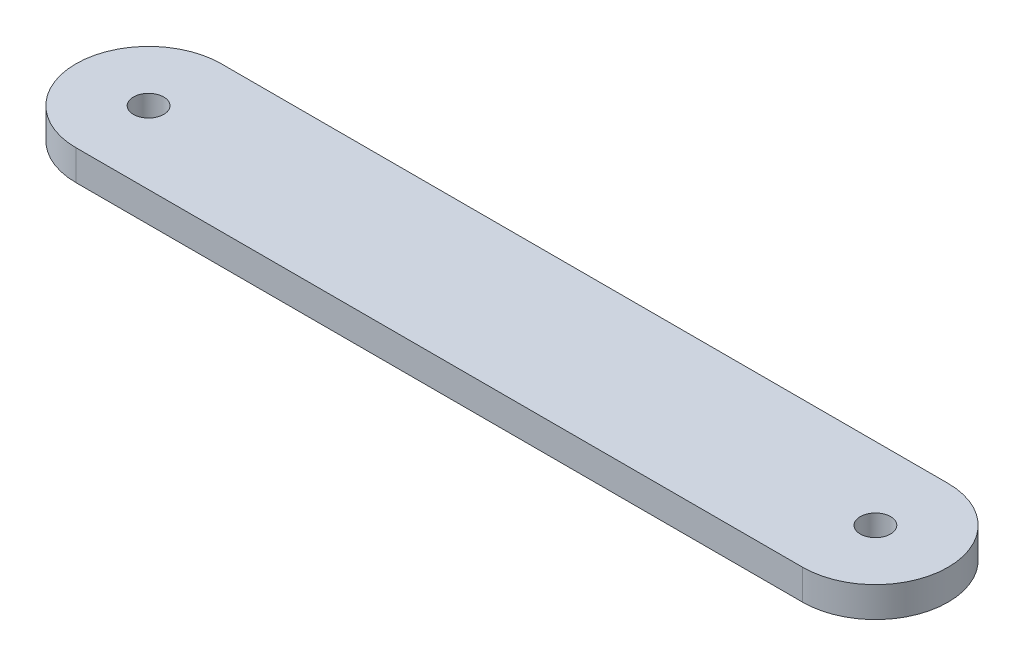
from build123d import *

# Parameters (mm, degrees)
SKETCH_1_R      = 2.5
EXTRUDE_1_DEPTH = 5


with BuildPart() as part:
    # Эскиз1 → Вытянуть1 (new body)
    with BuildSketch(Plane(origin=(0, 0, 0), x_dir=(1, 0, 0), z_dir=(0, 1, 0))):
        with BuildLine():
            Line((0, 10.177767955), (120, 10.177767955))
            ThreePointArc((120, 10.177767955), (132, -1.822232045), (120, -13.822232045))
            Line((120, -13.822232045), (0, -13.822232045))
            ThreePointArc((0, -13.822232045), (-12, -1.822232045), (0, 10.177767955))
        make_face()
        with Locations((0, -1.822232045)):
            Circle(SKETCH_1_R, mode=Mode.SUBTRACT)
        with Locations((120, -1.822232045)):
            Circle(SKETCH_1_R, mode=Mode.SUBTRACT)
    extrude(amount=EXTRUDE_1_DEPTH)


solid = part.part
